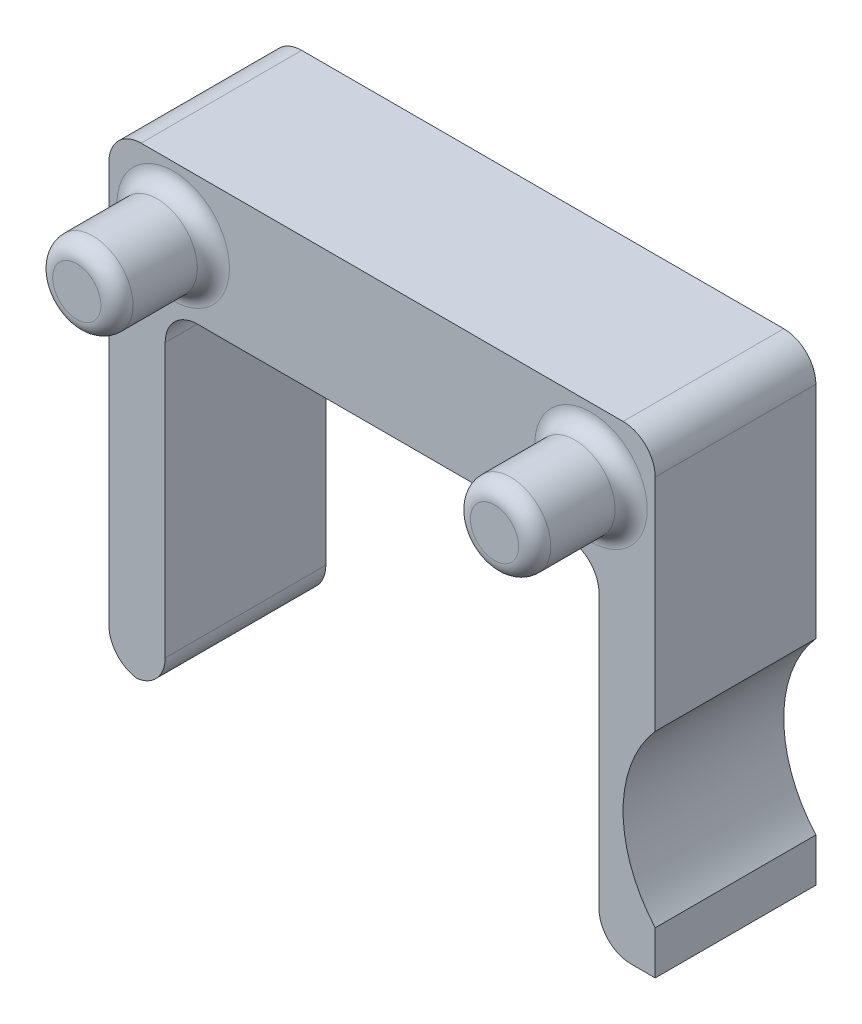
from build123d import *

# Parameters (mm, degrees)
SKETCH1_R                = 1.25
BOSS_EXTRUDE1_DEPTH      = 5
BOSS_EXTRUDE2_DEPTH      = 3
BOSS_EXTRUDE2_DEPTH_BACK = 5
SKETCH2_R                = 1.25
FILLET1_R                = 1
FILLET2_R                = 0.5


with BuildPart() as part:
    # Sketch1 → Boss-Extrude1 (new body)
    with BuildSketch(Plane.XY):
        with BuildLine():
            Line((-8.146317829, 1.615581395), (-8.146317829, -8.884418605))
            Line((-8.146317829, -8.884418605), (-9.896317829, -8.884418605))
            Line((-9.896317829, -8.884418605), (-9.896317829, 5.615581395))
            Line((-9.896317829, 5.615581395), (7.103682171, 5.615581395))
            Line((7.103682171, 5.615581395), (7.103682171, -2.238667294))
            ThreePointArc((7.103682171, -2.238667294), (6.103682171, -4.884418605), (7.103682171, -7.530169916))
            Line((7.103682171, -7.530169916), (7.103682171, -8.884418605))
            Line((7.103682171, -8.884418605), (5.353682171, -8.884418605))
            Line((5.353682171, -8.884418605), (5.353682171, 1.615581395))
            Line((5.353682171, 1.615581395), (-8.146317829, 1.615581395))
        make_face()
        with Locations((-7.896317829, 3.615581395)):
            Circle(SKETCH1_R, mode=Mode.SUBTRACT)
        with Locations((5.103682171, 3.615581395)):
            Circle(SKETCH1_R, mode=Mode.SUBTRACT)
    extrude(amount=BOSS_EXTRUDE1_DEPTH)

    # Sketch2 → Boss-Extrude2 (add, two sides: drawn at the far end of the back side and taken through both)
    with BuildSketch(Plane.XY.offset(5).offset(-BOSS_EXTRUDE2_DEPTH_BACK)):
        with Locations((-7.896317829, 3.615581395)):
            Circle(SKETCH2_R)
        with Locations((5.103682171, 3.615581395)):
            Circle(SKETCH2_R)
    extrude(amount=BOSS_EXTRUDE2_DEPTH + BOSS_EXTRUDE2_DEPTH_BACK)

    # Fillet1
    # the kernel refuses this fillet: 1 mm, written as the material it adds along each edge
    with BuildSketch(Plane(origin=(-8.146317829, 1.615581395, 0), x_dir=(1, 0, 0), z_dir=(0, 0, 1)), Plane(origin=(5.353682171, 1.615581395, 0), x_dir=(0, -1, 0), z_dir=(0, 0, 1))) as fillet1_piece_1:
        with BuildLine():
            CenterArc((FILLET1_R, -FILLET1_R), FILLET1_R, 90, 90)
            Line((0, -FILLET1_R), (0, 0))
            Line((0, 0), (FILLET1_R, 0))
        make_face()
    extrude(amount=5)
    # the kernel refuses this fillet: 1 mm, written as the material it takes off along each edge
    with BuildSketch(Plane(origin=(-8.146317829, -8.884418605, -2.5), x_dir=(0, 1, 0), z_dir=(0, 0, 1)), Plane(origin=(-9.896317829, -8.884418605, -2.5), x_dir=(1, 0, 0), z_dir=(0, 0, 1)), Plane(origin=(-9.896317829, 5.615581395, -2.5), x_dir=(0, -1, 0), z_dir=(0, 0, 1)), Plane(origin=(5.353682171, -8.884418605, -2.5), x_dir=(1, 0, 0), z_dir=(0, 0, 1))) as fillet1_2_piece_1:
        with BuildLine():
            CenterArc((FILLET1_R, FILLET1_R), FILLET1_R, 180, 90)
            Line((0, FILLET1_R), (0, 0))
            Line((0, 0), (FILLET1_R, 0))
        make_face()
    extrude(amount=10, mode=Mode.SUBTRACT)
    with BuildSketch(Plane(origin=(7.103682171, 5.615581395, -2.5), x_dir=(0, -1, 0), z_dir=(0, 0, 1))) as fillet1_2_piece_2:
        with BuildLine():
            CenterArc((FILLET1_R, -FILLET1_R), FILLET1_R, 90, 90)
            Line((0, -FILLET1_R), (0, 0))
            Line((0, 0), (FILLET1_R, 0))
        make_face()
    extrude(amount=10, mode=Mode.SUBTRACT)

    # Fillet2
    fillet2_edges = [part.edges().sort_by_distance(p)[0] for p in [
        (-9.146317829, 3.615581395, 5),
        (3.853682171, 3.615581395, 5),
        (-9.146317829, 3.615581395, 8),
        (3.853682171, 3.615581395, 8),
    ]]
    fillet(fillet2_edges, radius=FILLET2_R)


solid = part.part
